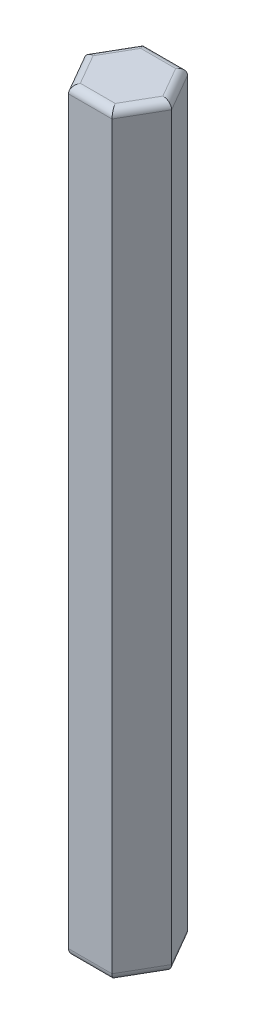
from build123d import *

# Parameters (mm, degrees)
RESSALTO_EXTRUS_O1_DEPTH = 50
FILETE1_R                = 0.5


with BuildPart() as part:
    # Esboço1 → Ressalto-extrusão1 (new body)
    with BuildSketch(Plane.XZ.offset(30)):
        Polygon((-1.443375673, -2.5), (1.443375673, -2.5), (2.886751346, 0), (1.443375673, 2.5), (-1.443375673, 2.5), (-2.886751346, 0), align=None)
    extrude(amount=-RESSALTO_EXTRUS_O1_DEPTH)

    # Filete1
    filete1_edges = [part.edges().sort_by_distance(p)[0] for p in [
        (0, -30, 2.5),
        (2.165063509, -30, 1.25),
        (-2.165063509, -30, 1.25),
        (2.165063509, -30, -1.25),
        (-2.165063509, -30, -1.25),
        (0, -30, -2.5),
        (0, 20, 2.5),
        (2.165063509, 20, 1.25),
        (-2.165063509, 20, 1.25),
        (2.165063509, 20, -1.25),
        (-2.165063509, 20, -1.25),
        (0, 20, -2.5),
    ]]
    fillet(filete1_edges, radius=FILETE1_R)


solid = part.part
